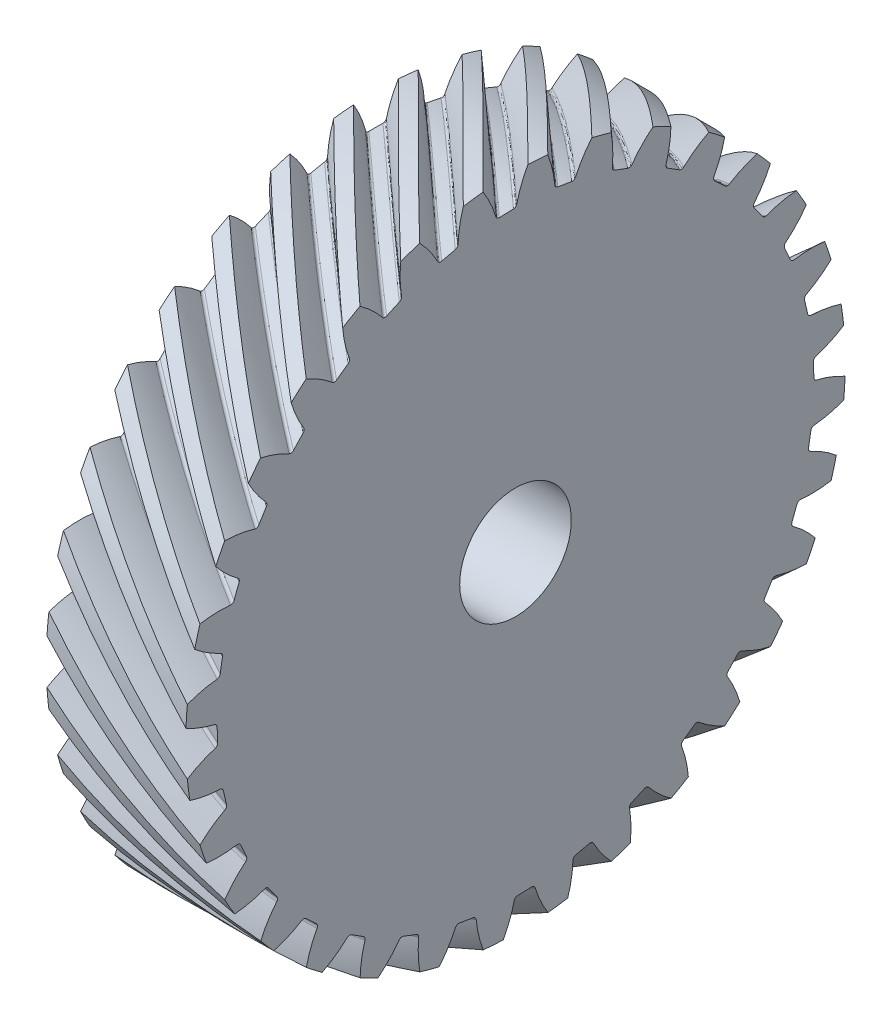
from build123d import *

# Parameters (mm, degrees)
BASPROSKE_W            = 25
BASPROSKE_H            = 59.068542495
TOOTHCUTRH_PITCH       = 371.138598321
TOOTHCUTRH_HEIGHT      = 25
TOOTHCUTRH_RADIUS      = 59.068542495
TOOTHCUTRH_START_ANGLE = -90
TEETHCUTSRH_COUNT      = 32
TEETHCUTSRH_ANGLE      = 348.75
BORSKE_R               = 10
BORE_DEPTH             = 62.5000025


with BuildPart() as part:
    # BasProSke → Base-Revolve (revolve)
    with BuildSketch(Plane(origin=(0, 0, 0), x_dir=(1, 0, 0), z_dir=(0, 1, 0)), mode=Mode.PRIVATE) as base_revolve_sk:
        with Locations((12.5, 29.534271248)):
            Rectangle(BASPROSKE_W, BASPROSKE_H)
    revolve(base_revolve_sk.sketch.rotate(Axis((-10, 0, 0), (1, 0, 0)), 180), axis=Axis((-10, 0, 0), (1, 0, 0)))

    # ToothCutRH: sweep along a helix
    with BuildLine() as toothcutrh_path:
        add(Helix(TOOTHCUTRH_PITCH, TOOTHCUTRH_HEIGHT, TOOTHCUTRH_RADIUS, center=(0, 0, 0), direction=(1, 0, 0), mode=Mode.PRIVATE).rotate(Axis((0, 0, 0), (1, 0, 0)), TOOTHCUTRH_START_ANGLE))
    # TooCutSkeRH → ToothCutRH (sweep, cut)
    with BuildSketch(Plane(origin=(0, 0, 0), x_dir=(0, 0, -1), z_dir=(1, 0, 0))):
        with BuildLine():
            ThreePointArc((1.259367948, 53.428702275), (0, 53.443542495), (-1.259367948, 53.428702275))
            ThreePointArc((-1.259367948, 53.428702275), (-1.649309952, 53.553421699), (-1.878778761, 53.892470024))
            ThreePointArc((-1.878778761, 53.892470024), (-3.186702767, 57.411446241), (-5.129212271, 60.624002179))
            ThreePointArc((-5.129212271, 60.624002179), (0, 60.84059877), (5.129212271, 60.624002179))
            ThreePointArc((5.129212271, 60.624002179), (3.186702767, 57.411446241), (1.878778761, 53.892470024))
            ThreePointArc((1.878778761, 53.892470024), (1.649309952, 53.553421699), (1.259367948, 53.428702275))
        make_face()
    toothcutrh = sweep(path=toothcutrh_path.line, is_frenet=True, mode=Mode.SUBTRACT)

    # TeethCutsRH: ToothCutRH ×32 about axis
    teethcutsrh_axis = Axis((-10, 0, 0), (1, 0, 0))
    for i in range(1, TEETHCUTSRH_COUNT):
        add(toothcutrh.rotate(teethcutsrh_axis, i * TEETHCUTSRH_ANGLE / (TEETHCUTSRH_COUNT - 1)), mode=Mode.SUBTRACT)

    # BorSke → Bore (cut, symmetric)
    with BuildSketch(Plane(origin=(0, 0, 0), x_dir=(0, 0, -1), z_dir=(1, 0, 0))):
        with Locations(Location((0, 0, 0), (0, 0, 180))):
            Circle(BORSKE_R)
    extrude(amount=BORE_DEPTH, both=True, mode=Mode.SUBTRACT)


solid = part.part
